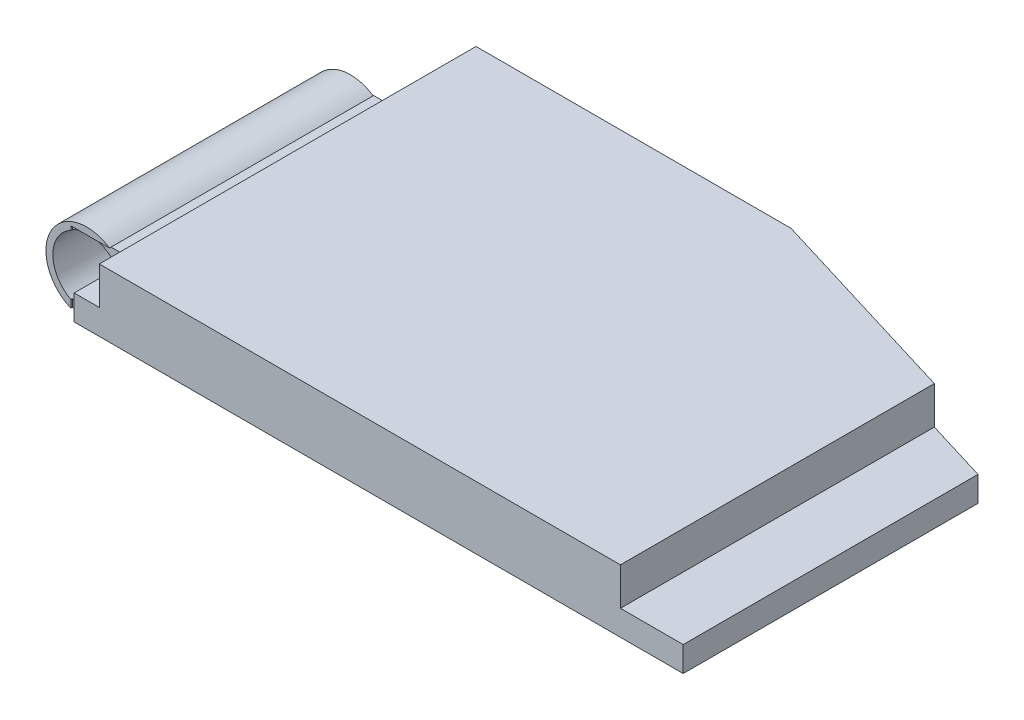
from build123d import *

# Parameters (mm, degrees)
SKETCH1_W                = 52
SKETCH1_H                = 30
BOSS_EXTRUDE1_DEPTH      = 2
SKETCH3_W                = 6
SKETCH3_H                = 3
BOSS_EXTRUDE3_DEPTH      = 7
SKETCH4_R                = 1
CUT_EXTRUDE1_DEPTH       = 56.342208124
BOSS_EXTRUDE4_DEPTH      = 10.5
BOSS_EXTRUDE4_DEPTH_BACK = 10.5
SKETCH5_R                = 3.25
SKETCH5_R_2              = 2.7
SKETCH6_R                = 2.7
CUT_EXTRUDE2_DEPTH       = 61.440052945
SKETCH7_W                = 4.769814724
SKETCH7_H                = 4.85426327
SKETCH7_W_2              = 3.5
SKETCH7_H_2              = 7.22194845
CUT_EXTRUDE3_DEPTH       = 61.704200843
SKETCH8_W                = 41.5
SKETCH8_H                = 30
BOSS_EXTRUDE5_DEPTH      = 3
CUT_EXTRUDE4_DEPTH       = 61.440052945


with BuildPart() as part:
    # Sketch1 → Boss-Extrude1 (new body)
    with BuildSketch(Plane(origin=(0, 0, 0), x_dir=(1, 0, 0), z_dir=(0, 1, 0))):
        with Locations((26, -15)):
            Rectangle(SKETCH1_W, SKETCH1_H)
    extrude(amount=BOSS_EXTRUDE1_DEPTH)

    # Sketch3 → Boss-Extrude3 (add)
    with BuildSketch(Plane.XZ):
        with Locations((26, 16.1)):
            Rectangle(SKETCH3_W, SKETCH3_H)
    extrude(amount=BOSS_EXTRUDE3_DEPTH)

    # Sketch4 → Cut-Extrude1 (cut, through all)
    with BuildSketch(Plane.XY.offset(17.6)):
        with Locations((26, -4)):
            Circle(SKETCH4_R)
    extrude(amount=-CUT_EXTRUDE1_DEPTH, mode=Mode.SUBTRACT)

    # Sketch6 → Cut-Extrude2 (cut, through all)
    with BuildSketch(Plane.XY.offset(30)):
        with Locations((0, -0.7)):
            Circle(SKETCH6_R)
    extrude(amount=-CUT_EXTRUDE2_DEPTH, mode=Mode.SUBTRACT)


with BuildPart() as body_2:
    # Sketch5 → Boss-Extrude4 (new, two sides: drawn at the far end of the back side and taken through both)
    with BuildSketch(Plane.XY.offset(15).offset(-BOSS_EXTRUDE4_DEPTH_BACK)):
        with Locations((0, -0.7)):
            Circle(SKETCH5_R)
        with Locations((0, -0.7)):
            Circle(SKETCH5_R_2, mode=Mode.SUBTRACT)
    extrude(amount=BOSS_EXTRUDE4_DEPTH + BOSS_EXTRUDE4_DEPTH_BACK)


with BuildPart() as cut_extrude3_tool:
    # Sketch7 → Cut-Extrude3 (new, through all)
    with BuildSketch(Plane(origin=(0, 2, 0), x_dir=(1, 0, 0), z_dir=(0, 1, 0))):
        with Locations((1.115092638, -27.796936494)):
            Rectangle(SKETCH7_W, SKETCH7_H)
        with Locations((1.75, -0.84897102)):
            Rectangle(SKETCH7_W_2, SKETCH7_H_2)
    extrude(amount=-CUT_EXTRUDE3_DEPTH)


with BuildPart() as part_1:
    add(part.part)

    # Cut-Extrude3: cut by cut_extrude3_tool
    add(cut_extrude3_tool.part, mode=Mode.SUBTRACT)

    # Sketch8 → Boss-Extrude5 (add)
    with BuildSketch(Plane(origin=(0, 2, 0), x_dir=(1, 0, 0), z_dir=(0, 1, 0))):
        with Locations((26.25, -15)):
            Rectangle(SKETCH8_W, SKETCH8_H)
    extrude(amount=BOSS_EXTRUDE5_DEPTH)

    # Sketch9 → Cut-Extrude4 (cut, through all)
    with BuildSketch(Plane.XZ):
        Polygon((30.583920936, 0), (52, 6.523601303), (52, -3.845596105), (30.583920936, -3.845596105), align=None)
    extrude(amount=-CUT_EXTRUDE4_DEPTH, mode=Mode.SUBTRACT)


with BuildPart() as body_2_1:
    add(body_2.part)

    # Cut-Extrude3: cut by cut_extrude3_tool
    add(cut_extrude3_tool.part, mode=Mode.SUBTRACT)


solid = Compound([part_1.part, body_2_1.part])
